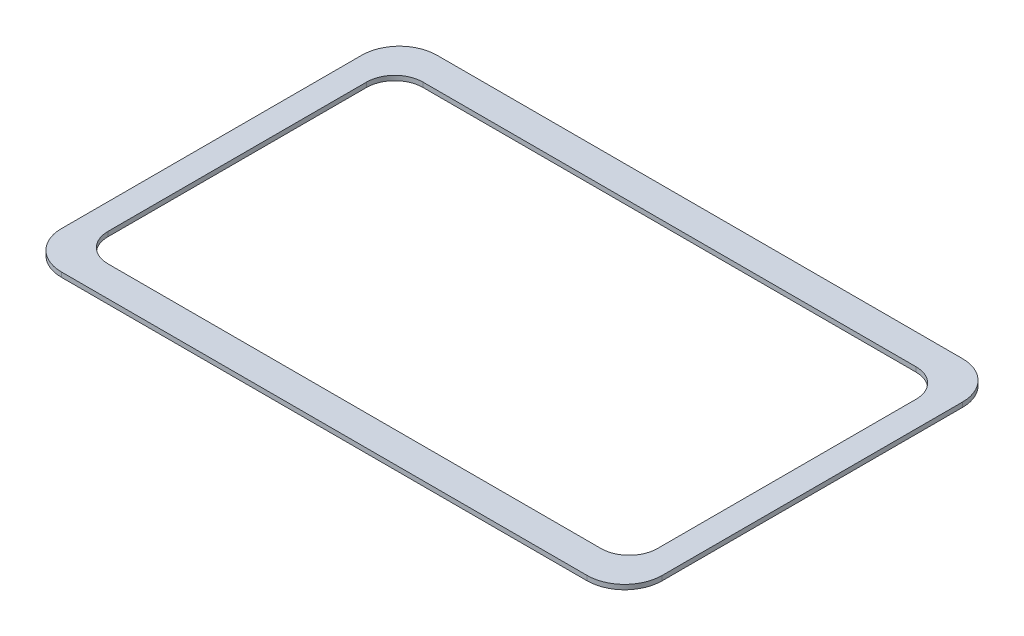
from build123d import *

# Parameters (mm, degrees)
MAINBODY_DEPTH = 1.5875


with BuildPart() as part:
    # Sketch2 → MainBody (new body)
    with BuildSketch(Plane(origin=(0, 49.034568419, 0), x_dir=(1, 0, 0), z_dir=(0, 1, 0))):
        with BuildLine():
            Line((74.712473168, 86.646627483), (-103.087526832, 86.646627483))
            ThreePointArc((-103.087526832, 86.646627483), (-112.067782953, 82.926883604), (-115.787526832, 73.946627483))
            Line((-115.787526832, 73.946627483), (-115.787526832, -27.653372517))
            ThreePointArc((-115.787526832, -27.653372517), (-112.067782953, -36.633628639), (-103.087526832, -40.353372517))
            Line((-103.087526832, -40.353372517), (74.712473168, -40.353372517))
            ThreePointArc((74.712473168, -40.353372517), (83.692729289, -36.633628639), (87.412473168, -27.653372517))
            Line((87.412473168, -27.653372517), (87.412473168, 73.946627483))
            ThreePointArc((87.412473168, 73.946627483), (83.692729289, 82.926883604), (74.712473168, 86.646627483))
        make_face()
        with BuildLine():
            Line((-97.584301976, -30.115902517), (69.209248312, -30.115902517))
            ThreePointArc((69.209248312, -30.115902517), (75.943542377, -27.326466583), (78.732978312, -20.592172517))
            Line((78.732978312, -20.592172517), (78.732978312, 66.885427483))
            ThreePointArc((78.732978312, 66.885427483), (75.943542377, 73.619721548), (69.209248312, 76.409157483))
            Line((69.209248312, 76.409157483), (-97.584301976, 76.409157483))
            ThreePointArc((-97.584301976, 76.409157483), (-104.318596042, 73.619721548), (-107.108031976, 66.885427483))
            Line((-107.108031976, 66.885427483), (-107.108031976, 23.146627483))
            Line((-107.108031976, 23.146627483), (-107.108031976, -20.592172517))
            ThreePointArc((-107.108031976, -20.592172517), (-104.318596042, -27.326466583), (-97.584301976, -30.115902517))
        make_face(mode=Mode.SUBTRACT)
    extrude(amount=MAINBODY_DEPTH)


solid = part.part
